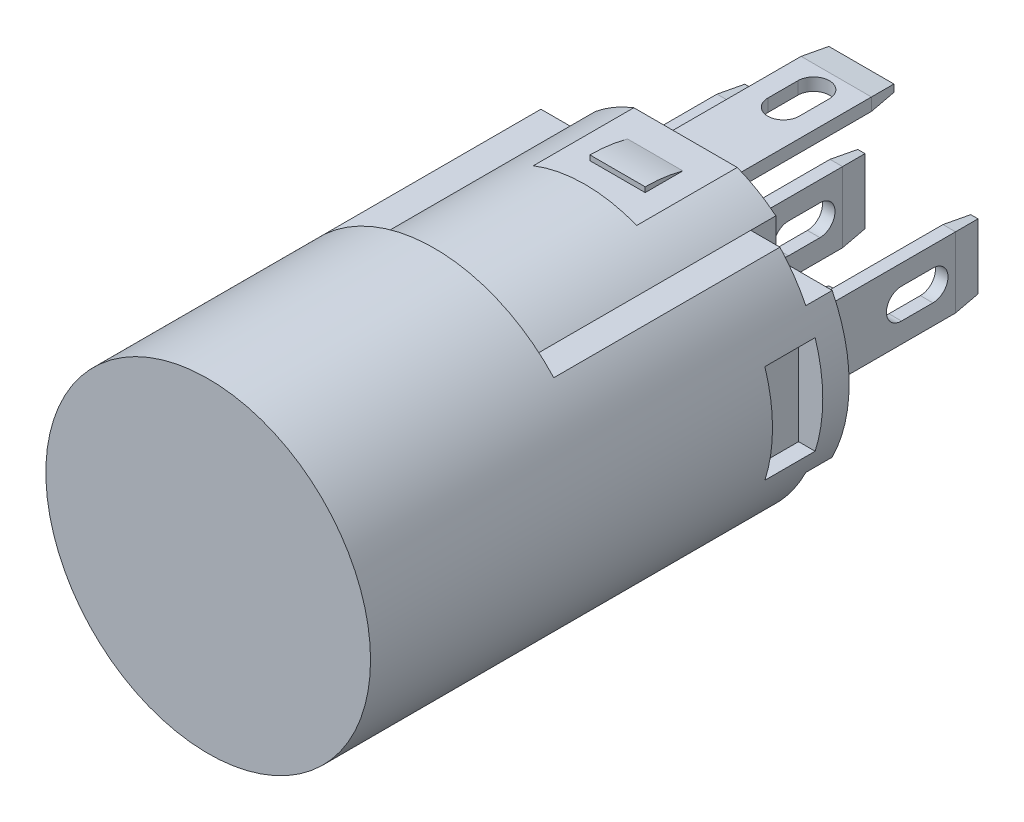
from build123d import *
from OCP.BRepFilletAPI import BRepFilletAPI_MakeChamfer

# Parameters (mm, degrees)
SKETCH1_R             = 6.462380214
BOSS_EXTRUDE1_DEPTH   = 19
CUT_EXTRUDE1_START    = -10
CUT_EXTRUDE1_DEPTH    = 10
SKETCH3_W             = 0.5
SKETCH3_H             = 2.8
BOSS_EXTRUDE2_DEPTH   = 7
SKETCH3_W_2           = 2.8
SKETCH3_H_2           = 0.5
BOSS_EXTRUDE2_2_DEPTH = 7
BOSS_EXTRUDE2_3_DEPTH = 7
BOSS_EXTRUDE2_4_DEPTH = 7
BOSS_EXTRUDE2_5_DEPTH = 7
CHAMFER1_SIZE         = 1
CHAMFER1_SIZE2        = 0.105104235
CHAMFER2_SIZE         = 1
CHAMFER2_SIZE2        = 0.105104235
CHAMFER3_SIZE         = 1
CHAMFER3_SIZE2        = 0.105104235
CHAMFER4_SIZE         = 1
CHAMFER4_SIZE2        = 0.105104235
CHAMFER5_SIZE         = 1
CHAMFER5_SIZE2        = 0.105104235
CUT_EXTRUDE2_DEPTH    = 15
CUT_EXTRUDE3_DEPTH    = 15
CUT_EXTRUDE4_START    = -1
CUT_EXTRUDE4_DEPTH    = 1
SKETCH8_W             = 8.882944393
SKETCH8_H             = 5.949994893
SKETCH8_W_2           = 9.676756497
SKETCH8_H_2           = 2.378455265
CUT_EXTRUDE5_DEPTH    = 4
SKETCH10_W            = 1.25
SKETCH10_H            = 1
CUT_EXTRUDE6_DEPTH    = 0.3
BOSS_EXTRUDE4_DEPTH   = 0.05
SKETCH12_W            = 0.6
SKETCH12_H            = 2.9
SKETCH12_W_2          = 2.9
SKETCH12_H_2          = 0.6
CUT_EXTRUDE7_DEPTH    = 0.5
SKETCH13_W            = 0.5
SKETCH13_H            = 2.8
SKETCH13_W_2          = 2.8
SKETCH13_H_2          = 0.5
BOSS_EXTRUDE5_DEPTH   = 0.5
SKETCH15_W            = 0.4
SKETCH15_H            = 0.2
SKETCH15_W_2          = 0.2
SKETCH15_H_2          = 0.4
SKETCH15_H_3          = 1
BOSS_EXTRUDE6_DEPTH   = 0.1
SKETCH16_W            = 2.2
SKETCH16_H            = 1.5
BOSS_EXTRUDE7_DEPTH   = 0.2
SKETCH17_W            = 2.2
SKETCH17_H            = 1.5
BOSS_EXTRUDE8_DEPTH   = 0.2
FILLET2_R             = 5.725
CUT_EXTRUDE9_DEPTH    = 0.2
SKETCH19_W            = 2
SKETCH19_H            = 3.916637546
CUT_EXTRUDE10_DEPTH   = 4.5


# Read off the part's stored shape, not the designer's step: Boss-Extrude4
with BuildPart() as part:
    # Sketch1 → Boss-Extrude1 (new body)
    with BuildSketch(Plane.XY):
        Circle(SKETCH1_R)
    extrude(amount=-BOSS_EXTRUDE1_DEPTH)

    # Sketch2 → Cut-Extrude1 (cut)
    with BuildSketch(Plane(origin=(0, 0, -19), x_dir=(-1, 0, 0), z_dir=(0, 0, -1)).offset(CUT_EXTRUDE1_START)):
        with BuildLine():
            ThreePointArc((4.756230968, 4.375), (0, 6.462380214), (-4.756230968, 4.375))
            Line((-4.756230968, 4.375), (-3.594707872, 4.375))
            ThreePointArc((-3.594707872, 4.375), (0, 5.662380214), (3.594707872, 4.375))
            Line((3.594707872, 4.375), (4.756230968, 4.375))
        make_face()
        with BuildLine():
            Line((-3.594707872, -4.375), (-4.756230968, -4.375))
            ThreePointArc((-4.756230968, -4.375), (0, -6.462380214), (4.756230968, -4.375))
            Line((4.756230968, -4.375), (3.594707872, -4.375))
            ThreePointArc((3.594707872, -4.375), (0, -5.662380214), (-3.594707872, -4.375))
        make_face()
    extrude(amount=CUT_EXTRUDE1_DEPTH, mode=Mode.SUBTRACT)

    # Sketch7 → Cut-Extrude4 (cut)
    with BuildSketch(Plane(origin=(0, 0, -19), x_dir=(-1, 0, 0), z_dir=(0, 0, -1)).offset(CUT_EXTRUDE4_START)):
        with BuildLine():
            Line((3.594707872, -2.875), (3.594707872, -4.375))
            Line((3.594707872, -4.375), (4.756230968, -4.375))
            ThreePointArc((4.756230968, -4.375), (5.325014913, -3.661498901), (5.787636221, -2.875))
            Line((5.787636221, -2.875), (3.594707872, -2.875))
        make_face()
        with BuildLine():
            Line((-4.756230968, -4.375), (-3.594707872, -4.375))
            Line((-3.594707872, -4.375), (-3.594707872, -2.875))
            Line((-3.594707872, -2.875), (-5.787636221, -2.875))
            ThreePointArc((-5.787636221, -2.875), (-5.325014913, -3.661498901), (-4.756230968, -4.375))
        make_face()
        with BuildLine():
            ThreePointArc((-4.756230968, 4.375), (-5.325014913, 3.661498901), (-5.787636221, 2.875))
            Line((-5.787636221, 2.875), (-3.594707872, 2.875))
            Line((-3.594707872, 2.875), (-3.594707872, 4.375))
            Line((-3.594707872, 4.375), (-4.756230968, 4.375))
        make_face()
        with BuildLine():
            Line((3.594707872, 2.875), (5.787636221, 2.875))
            ThreePointArc((5.787636221, 2.875), (5.325014913, 3.661498901), (4.756230968, 4.375))
            Line((4.756230968, 4.375), (3.594707872, 4.375))
            Line((3.594707872, 4.375), (3.594707872, 2.875))
        make_face()
    extrude(amount=CUT_EXTRUDE4_DEPTH, mode=Mode.SUBTRACT)

    # Sketch8 → Cut-Extrude5 (cut)
    with BuildSketch(Plane(origin=(0, 0, -19), x_dir=(-1, 0, 0), z_dir=(0, 0, -1))):
        with Locations((0.00649082, 8.249997447)):
            Rectangle(SKETCH8_W, SKETCH8_H)
        with Locations((0.006490821, -6.464227633)):
            Rectangle(SKETCH8_W_2, SKETCH8_H_2)
    extrude(amount=-CUT_EXTRUDE5_DEPTH, mode=Mode.SUBTRACT)

    # Sketch10 → Cut-Extrude6 (cut)
    with BuildSketch(Plane(origin=(0, 0, -19), x_dir=(-1, 0, 0), z_dir=(0, 0, -1))):
        with Locations((0, 3.375)):
            Rectangle(SKETCH10_W, SKETCH10_H)
        with Locations((0, -3.375)):
            Rectangle(SKETCH10_W, SKETCH10_H)
    extrude(amount=-CUT_EXTRUDE6_DEPTH, mode=Mode.SUBTRACT)

    # Boss-Extrude4 outline → Boss-Extrude4 (add)
    with BuildSketch(Plane(origin=(0, 0, -19), x_dir=(-1, 0, 0), z_dir=(0, 0, -1))):
        with BuildLine():
            ThreePointArc((5.787636221, -2.875), (6.462380214, 0), (5.787636221, 2.875))
            Line((5.787636221, 2.875), (-5.787636221, 2.875))
            ThreePointArc((-5.787636221, 2.875), (-6.462380214, 0), (-5.787636221, -2.875))
            Line((-5.787636221, -2.875), (5.787636221, -2.875))
        make_face()
    extrude(amount=BOSS_EXTRUDE4_DEPTH)

    # Sketch12 → Cut-Extrude7 (cut, symmetric)
    with BuildSketch(Plane(origin=(0, 0, -19.05), x_dir=(-1, 0, 0), z_dir=(0, 0, -1))):
        with Locations((-4.496812591, 0)):
            Rectangle(SKETCH12_W, SKETCH12_H)
        Rectangle(SKETCH12_W, SKETCH12_H)
        with Locations((4.496812591, 0)):
            Rectangle(SKETCH12_W, SKETCH12_H)
        with Locations((0, 4.125)):
            Rectangle(SKETCH12_W_2, SKETCH12_H_2)
        with Locations((0, -4.125)):
            Rectangle(SKETCH12_W_2, SKETCH12_H_2)
    extrude(amount=CUT_EXTRUDE7_DEPTH, both=True, mode=Mode.SUBTRACT)

    # Sketch15 → Boss-Extrude6 (add)
    with BuildSketch(Plane(origin=(0, 0, -19), x_dir=(-1, 0, 0), z_dir=(0, 0, -1))):
        with Locations((2.129333431, -4.075)):
            Rectangle(SKETCH15_W, SKETCH15_H)
        with Locations((2.429333431, -4.375)):
            Rectangle(SKETCH15_W_2, SKETCH15_H_2)
        with Locations((2.729333431, -4.075)):
            Rectangle(SKETCH15_W, SKETCH15_H)
        with Locations((2.429333431, -4.075)):
            Rectangle(SKETCH15_W_2, SKETCH15_H)
        with Locations((2.429333431, -3.775)):
            Rectangle(SKETCH15_W_2, SKETCH15_H_2)
        with Locations((2.429333431, 4.075)):
            Rectangle(SKETCH15_W_2, SKETCH15_H_3)
    extrude(amount=BOSS_EXTRUDE6_DEPTH)

    # Sketch16 → Boss-Extrude7 (add)
    with BuildSketch(Plane.XZ.offset(5.275)):
        with Locations((-0.004713943, -17.05)):
            Rectangle(SKETCH16_W, SKETCH16_H)
    extrude(amount=BOSS_EXTRUDE7_DEPTH)

    # Sketch17 → Boss-Extrude8 (add)
    with BuildSketch(Plane(origin=(0, 5.275, 0), x_dir=(1, 0, 0), z_dir=(0, 1, 0))):
        with Locations((-0.004713943, 17.05)):
            Rectangle(SKETCH17_W, SKETCH17_H)
    extrude(amount=BOSS_EXTRUDE8_DEPTH)

    # Fillet2
    # the kernel refuses this fillet: 5.725 mm, written as the material it takes off along each edge
    with BuildSketch(Plane(origin=(-4.854713943, -5.475, -17.8), x_dir=(0, 1, 0), z_dir=(1, 0, 0)), Plane(origin=(4.845286057, 5.475, -17.8), x_dir=(0, -1, 0), z_dir=(-1, 0, 0))) as fillet2_piece_1:
        with BuildLine():
            CenterArc((5.725, 1.5), FILLET2_R, 180, 15.189286737)
            Line((0, 1.5), (-0.1145, 1.5))
            Line((-0.1145, 1.5), (-0.1145, 0))
            Line((-0.1145, 0), (0, -0.1145))
            ThreePointArc((0, -0.1145), (0.1, -0.1145), (0.0895, -0.03))
            Line((0.0895, -0.03), (0.2, 0))
        make_face()
    extrude(amount=9.7, mode=Mode.SUBTRACT)

    # Sketch14 → Cut-Extrude9 (cut)
    with BuildSketch(Plane(origin=(0, 0, -19.05), x_dir=(-1, 0, 0), z_dir=(0, 0, -1))):
        with BuildLine():
            Line((-4.696812591, 2.25), (-3.696812591, 2.25))
            ThreePointArc((-3.696812591, 2.25), (-3.555391234, 2.191421356), (-3.496812591, 2.05))
            Line((-3.496812591, 2.05), (-3.496812591, -0.05))
            ThreePointArc((-3.496812591, -0.05), (-3.438233947, -0.191421356), (-3.296812591, -0.25))
            Line((-3.296812591, -0.25), (-2.796812591, -0.25))
            ThreePointArc((-2.796812591, -0.25), (-2.655391234, -0.308578644), (-2.596812591, -0.45))
            Line((-2.596812591, -0.45), (-2.596812591, -2.05))
            ThreePointArc((-2.596812591, -2.05), (-2.655391234, -2.191421356), (-2.796812591, -2.25))
            Line((-2.796812591, -2.25), (-3.296812591, -2.25))
            Line((-3.296812591, -2.25), (-4.696812591, -2.25))
            ThreePointArc((-4.696812591, -2.25), (-4.838233947, -2.191421356), (-4.896812591, -2.05))
            Line((-4.896812591, -2.05), (-4.896812591, 2.05))
            ThreePointArc((-4.896812591, 2.05), (-4.838233947, 2.191421356), (-4.696812591, 2.25))
        make_face()
        with BuildLine():
            Line((4.896812591, 2.05), (4.896812591, -2.05))
            ThreePointArc((4.896812591, -2.05), (4.838233947, -2.191421356), (4.696812591, -2.25))
            Line((4.696812591, -2.25), (3.696812591, -2.25))
            ThreePointArc((3.696812591, -2.25), (3.555391234, -2.191421356), (3.496812591, -2.05))
            Line((3.496812591, -2.05), (3.496812591, -0.05))
            Line((3.496812591, -0.05), (3.496812591, 0.05))
            ThreePointArc((3.496812591, 0.05), (3.438233947, 0.191421356), (3.296812591, 0.25))
            Line((3.296812591, 0.25), (2.796812591, 0.25))
            ThreePointArc((2.796812591, 0.25), (2.655391234, 0.308578644), (2.596812591, 0.45))
            Line((2.596812591, 0.45), (2.596812591, 2.05))
            ThreePointArc((2.596812591, 2.05), (2.655391234, 2.191421356), (2.796812591, 2.25))
            Line((2.796812591, 2.25), (3.296812591, 2.25))
            Line((3.296812591, 2.25), (3.696812591, 2.25))
            Line((3.696812591, 2.25), (4.696812591, 2.25))
            ThreePointArc((4.696812591, 2.25), (4.838233947, 2.191421356), (4.896812591, 2.05))
        make_face()
        with BuildLine():
            Line((-1.7, 2.25), (0.2, 2.25))
            ThreePointArc((0.2, 2.25), (0.341421356, 2.191421356), (0.4, 2.05))
            Line((0.4, 2.05), (0.4, -2.05))
            ThreePointArc((0.4, -2.05), (0.341421356, -2.191421356), (0.2, -2.25))
            Line((0.2, -2.25), (-0.8, -2.25))
            ThreePointArc((-0.8, -2.25), (-0.941421356, -2.191421356), (-1, -2.05))
            Line((-1, -2.05), (-1, 0.05))
            ThreePointArc((-1, 0.05), (-1.058578644, 0.191421356), (-1.2, 0.25))
            Line((-1.2, 0.25), (-1.7, 0.25))
            ThreePointArc((-1.7, 0.25), (-1.841421356, 0.308578644), (-1.9, 0.45))
            Line((-1.9, 0.45), (-1.9, 2.05))
            ThreePointArc((-1.9, 2.05), (-1.841421356, 2.191421356), (-1.7, 2.25))
        make_face()
    extrude(amount=-CUT_EXTRUDE9_DEPTH, mode=Mode.SUBTRACT)

    # Sketch19 → Cut-Extrude10 (cut)
    with BuildSketch(Plane(origin=(10, 0, 0), x_dir=(0, 0, -1), z_dir=(1, 0, 0))):
        with Locations((17, 0)):
            Rectangle(SKETCH19_W, SKETCH19_H)
    cut_extrude10 = extrude(amount=-CUT_EXTRUDE10_DEPTH, mode=Mode.SUBTRACT)

    # Mirror1: Cut-Extrude10 across plane
    add(cut_extrude10.mirror(Plane(origin=(0, 0, 0), x_dir=(0, 0, 1), z_dir=(1, 0, 0))), mode=Mode.SUBTRACT)


with BuildPart() as body_2:
    # Sketch3 → Boss-Extrude2 (new body)
    with BuildSketch(Plane(origin=(0, 0, -19), x_dir=(-1, 0, 0), z_dir=(0, 0, -1))):
        with Locations((-4.496812591, 0)):
            Rectangle(SKETCH3_W, SKETCH3_H)
    extrude(amount=BOSS_EXTRUDE2_DEPTH)

    # Chamfer2: one chamfer whose edges measure the first distance from different faces: ONE call of the kernel's chamfer builder (chamfer() names one face for all edges)
    chamfer2_edges_1 = [body_2.edges().sort_by_distance(p)[0] for p in [
        (4.246812591, 0, -26),
    ]]
    chamfer2_side_1 = [body_2.faces().sort_by_distance(p)[0] for p in [
        (4.246812591, 0, -22.5),
    ]]
    chamfer2_edges_2 = [body_2.edges().sort_by_distance(p)[0] for p in [
        (4.496812591, 1.4, -26),
    ]]
    chamfer2_side_2 = [body_2.faces().sort_by_distance(p)[0] for p in [
        (4.496812591, 1.4, -22.5),
    ]]
    chamfer2_edges_3 = [body_2.edges().sort_by_distance(p)[0] for p in [
        (4.746812591, 0, -26),
    ]]
    chamfer2_side_3 = [body_2.faces().sort_by_distance(p)[0] for p in [
        (4.746812591, 0, -22.5),
    ]]
    chamfer2_edges_4 = [body_2.edges().sort_by_distance(p)[0] for p in [
        (4.496812591, -1.4, -26),
    ]]
    chamfer2_side_4 = [body_2.faces().sort_by_distance(p)[0] for p in [
        (4.496812591, -1.4, -22.5),
    ]]
    chamfer2 = BRepFilletAPI_MakeChamfer(body_2.part.solid().wrapped)
    for e in chamfer2_edges_1:
        chamfer2.Add(CHAMFER2_SIZE, CHAMFER2_SIZE2, e.wrapped, chamfer2_side_1[0].wrapped)  # the first distance lies on this face
    for e in chamfer2_edges_2:
        chamfer2.Add(CHAMFER2_SIZE, CHAMFER2_SIZE2, e.wrapped, chamfer2_side_2[0].wrapped)  # the first distance lies on this face
    for e in chamfer2_edges_3:
        chamfer2.Add(CHAMFER2_SIZE, CHAMFER2_SIZE2, e.wrapped, chamfer2_side_3[0].wrapped)  # the first distance lies on this face
    for e in chamfer2_edges_4:
        chamfer2.Add(CHAMFER2_SIZE, CHAMFER2_SIZE2, e.wrapped, chamfer2_side_4[0].wrapped)  # the first distance lies on this face
    add(Compound.cast(chamfer2.Shape()), mode=Mode.REPLACE)


with BuildPart() as body_3:
    # Sketch3 → Boss-Extrude2 2 (new body)
    with BuildSketch(Plane(origin=(0, 0, -19), x_dir=(-1, 0, 0), z_dir=(0, 0, -1))):
        with Locations((0, 4.125)):
            Rectangle(SKETCH3_W_2, SKETCH3_H_2)
    extrude(amount=BOSS_EXTRUDE2_2_DEPTH)

    # Chamfer4: one chamfer whose edges measure the first distance from different faces: ONE call of the kernel's chamfer builder (chamfer() names one face for all edges)
    chamfer4_edges_1 = [body_3.edges().sort_by_distance(p)[0] for p in [
        (1.4, 4.125, -26),
    ]]
    chamfer4_side_1 = [body_3.faces().sort_by_distance(p)[0] for p in [
        (1.4, 4.125, -22.5),
    ]]
    chamfer4_edges_2 = [body_3.edges().sort_by_distance(p)[0] for p in [
        (0, 3.875, -26),
    ]]
    chamfer4_side_2 = [body_3.faces().sort_by_distance(p)[0] for p in [
        (0, 3.875, -22.5),
    ]]
    chamfer4_edges_3 = [body_3.edges().sort_by_distance(p)[0] for p in [
        (-1.4, 4.125, -26),
    ]]
    chamfer4_side_3 = [body_3.faces().sort_by_distance(p)[0] for p in [
        (-1.4, 4.125, -22.5),
    ]]
    chamfer4_edges_4 = [body_3.edges().sort_by_distance(p)[0] for p in [
        (0, 4.375, -26),
    ]]
    chamfer4_side_4 = [body_3.faces().sort_by_distance(p)[0] for p in [
        (0, 4.375, -22.5),
    ]]
    chamfer4 = BRepFilletAPI_MakeChamfer(body_3.part.solid().wrapped)
    for e in chamfer4_edges_1:
        chamfer4.Add(CHAMFER4_SIZE, CHAMFER4_SIZE2, e.wrapped, chamfer4_side_1[0].wrapped)  # the first distance lies on this face
    for e in chamfer4_edges_2:
        chamfer4.Add(CHAMFER4_SIZE, CHAMFER4_SIZE2, e.wrapped, chamfer4_side_2[0].wrapped)  # the first distance lies on this face
    for e in chamfer4_edges_3:
        chamfer4.Add(CHAMFER4_SIZE, CHAMFER4_SIZE2, e.wrapped, chamfer4_side_3[0].wrapped)  # the first distance lies on this face
    for e in chamfer4_edges_4:
        chamfer4.Add(CHAMFER4_SIZE, CHAMFER4_SIZE2, e.wrapped, chamfer4_side_4[0].wrapped)  # the first distance lies on this face
    add(Compound.cast(chamfer4.Shape()), mode=Mode.REPLACE)


with BuildPart() as body_4:
    # Sketch3 → Boss-Extrude2 3 (new body)
    with BuildSketch(Plane(origin=(0, 0, -19), x_dir=(-1, 0, 0), z_dir=(0, 0, -1))):
        with Locations((0, -4.125)):
            Rectangle(SKETCH3_W_2, SKETCH3_H_2)
    extrude(amount=BOSS_EXTRUDE2_3_DEPTH)

    # Chamfer5: one chamfer whose edges measure the first distance from different faces: ONE call of the kernel's chamfer builder (chamfer() names one face for all edges)
    chamfer5_edges_1 = [body_4.edges().sort_by_distance(p)[0] for p in [
        (-1.4, -4.125, -26),
    ]]
    chamfer5_side_1 = [body_4.faces().sort_by_distance(p)[0] for p in [
        (-1.4, -4.125, -22.5),
    ]]
    chamfer5_edges_2 = [body_4.edges().sort_by_distance(p)[0] for p in [
        (0, -3.875, -26),
    ]]
    chamfer5_side_2 = [body_4.faces().sort_by_distance(p)[0] for p in [
        (0, -3.875, -22.5),
    ]]
    chamfer5_edges_3 = [body_4.edges().sort_by_distance(p)[0] for p in [
        (1.4, -4.125, -26),
    ]]
    chamfer5_side_3 = [body_4.faces().sort_by_distance(p)[0] for p in [
        (1.4, -4.125, -22.5),
    ]]
    chamfer5_edges_4 = [body_4.edges().sort_by_distance(p)[0] for p in [
        (0, -4.375, -26),
    ]]
    chamfer5_side_4 = [body_4.faces().sort_by_distance(p)[0] for p in [
        (0, -4.375, -22.5),
    ]]
    chamfer5 = BRepFilletAPI_MakeChamfer(body_4.part.solid().wrapped)
    for e in chamfer5_edges_1:
        chamfer5.Add(CHAMFER5_SIZE, CHAMFER5_SIZE2, e.wrapped, chamfer5_side_1[0].wrapped)  # the first distance lies on this face
    for e in chamfer5_edges_2:
        chamfer5.Add(CHAMFER5_SIZE, CHAMFER5_SIZE2, e.wrapped, chamfer5_side_2[0].wrapped)  # the first distance lies on this face
    for e in chamfer5_edges_3:
        chamfer5.Add(CHAMFER5_SIZE, CHAMFER5_SIZE2, e.wrapped, chamfer5_side_3[0].wrapped)  # the first distance lies on this face
    for e in chamfer5_edges_4:
        chamfer5.Add(CHAMFER5_SIZE, CHAMFER5_SIZE2, e.wrapped, chamfer5_side_4[0].wrapped)  # the first distance lies on this face
    add(Compound.cast(chamfer5.Shape()), mode=Mode.REPLACE)


with BuildPart() as body_5:
    # Sketch3 → Boss-Extrude2 4 (new body)
    with BuildSketch(Plane(origin=(0, 0, -19), x_dir=(-1, 0, 0), z_dir=(0, 0, -1))):
        with Locations((4.496812591, 0)):
            Rectangle(SKETCH3_W, SKETCH3_H)
    extrude(amount=BOSS_EXTRUDE2_4_DEPTH)

    # Chamfer1: one chamfer whose edges measure the first distance from different faces: ONE call of the kernel's chamfer builder (chamfer() names one face for all edges)
    chamfer1_edges_1 = [body_5.edges().sort_by_distance(p)[0] for p in [
        (-4.746812591, 0, -26),
    ]]
    chamfer1_side_1 = [body_5.faces().sort_by_distance(p)[0] for p in [
        (-4.746812591, 0, -22.5),
    ]]
    chamfer1_edges_2 = [body_5.edges().sort_by_distance(p)[0] for p in [
        (-4.496812591, 1.4, -26),
    ]]
    chamfer1_side_2 = [body_5.faces().sort_by_distance(p)[0] for p in [
        (-4.496812591, 1.4, -22.5),
    ]]
    chamfer1_edges_3 = [body_5.edges().sort_by_distance(p)[0] for p in [
        (-4.246812591, 0, -26),
    ]]
    chamfer1_side_3 = [body_5.faces().sort_by_distance(p)[0] for p in [
        (-4.246812591, 0, -22.5),
    ]]
    chamfer1_edges_4 = [body_5.edges().sort_by_distance(p)[0] for p in [
        (-4.496812591, -1.4, -26),
    ]]
    chamfer1_side_4 = [body_5.faces().sort_by_distance(p)[0] for p in [
        (-4.496812591, -1.4, -22.5),
    ]]
    chamfer1 = BRepFilletAPI_MakeChamfer(body_5.part.solid().wrapped)
    for e in chamfer1_edges_1:
        chamfer1.Add(CHAMFER1_SIZE, CHAMFER1_SIZE2, e.wrapped, chamfer1_side_1[0].wrapped)  # the first distance lies on this face
    for e in chamfer1_edges_2:
        chamfer1.Add(CHAMFER1_SIZE, CHAMFER1_SIZE2, e.wrapped, chamfer1_side_2[0].wrapped)  # the first distance lies on this face
    for e in chamfer1_edges_3:
        chamfer1.Add(CHAMFER1_SIZE, CHAMFER1_SIZE2, e.wrapped, chamfer1_side_3[0].wrapped)  # the first distance lies on this face
    for e in chamfer1_edges_4:
        chamfer1.Add(CHAMFER1_SIZE, CHAMFER1_SIZE2, e.wrapped, chamfer1_side_4[0].wrapped)  # the first distance lies on this face
    add(Compound.cast(chamfer1.Shape()), mode=Mode.REPLACE)


with BuildPart() as body_6:
    # Sketch3 → Boss-Extrude2 5 (new body)
    with BuildSketch(Plane(origin=(0, 0, -19), x_dir=(-1, 0, 0), z_dir=(0, 0, -1))):
        Rectangle(SKETCH3_W, SKETCH3_H)
    extrude(amount=BOSS_EXTRUDE2_5_DEPTH)

    # Chamfer3: one chamfer whose edges measure the first distance from different faces: ONE call of the kernel's chamfer builder (chamfer() names one face for all edges)
    chamfer3_edges_1 = [body_6.edges().sort_by_distance(p)[0] for p in [
        (-0.25, 0, -26),
    ]]
    chamfer3_side_1 = [body_6.faces().sort_by_distance(p)[0] for p in [
        (-0.25, 0, -22.5),
    ]]
    chamfer3_edges_2 = [body_6.edges().sort_by_distance(p)[0] for p in [
        (0, 1.4, -26),
    ]]
    chamfer3_side_2 = [body_6.faces().sort_by_distance(p)[0] for p in [
        (0, 1.4, -22.5),
    ]]
    chamfer3_edges_3 = [body_6.edges().sort_by_distance(p)[0] for p in [
        (0.25, 0, -26),
    ]]
    chamfer3_side_3 = [body_6.faces().sort_by_distance(p)[0] for p in [
        (0.25, 0, -22.5),
    ]]
    chamfer3_edges_4 = [body_6.edges().sort_by_distance(p)[0] for p in [
        (0, -1.4, -26),
    ]]
    chamfer3_side_4 = [body_6.faces().sort_by_distance(p)[0] for p in [
        (0, -1.4, -22.5),
    ]]
    chamfer3 = BRepFilletAPI_MakeChamfer(body_6.part.solid().wrapped)
    for e in chamfer3_edges_1:
        chamfer3.Add(CHAMFER3_SIZE, CHAMFER3_SIZE2, e.wrapped, chamfer3_side_1[0].wrapped)  # the first distance lies on this face
    for e in chamfer3_edges_2:
        chamfer3.Add(CHAMFER3_SIZE, CHAMFER3_SIZE2, e.wrapped, chamfer3_side_2[0].wrapped)  # the first distance lies on this face
    for e in chamfer3_edges_3:
        chamfer3.Add(CHAMFER3_SIZE, CHAMFER3_SIZE2, e.wrapped, chamfer3_side_3[0].wrapped)  # the first distance lies on this face
    for e in chamfer3_edges_4:
        chamfer3.Add(CHAMFER3_SIZE, CHAMFER3_SIZE2, e.wrapped, chamfer3_side_4[0].wrapped)  # the first distance lies on this face
    add(Compound.cast(chamfer3.Shape()), mode=Mode.REPLACE)


with BuildPart() as cut_extrude2_tool:
    # Sketch4 → Cut-Extrude2 (new body)
    with BuildSketch(Plane(origin=(4.746812591, 0, 0), x_dir=(0, 0, -1), z_dir=(1, 0, 0))):
        with BuildLine():
            Line((22.85, 0.6), (24.1, 0.6))
            ThreePointArc((24.1, 0.6), (24.7, 0), (24.1, -0.6))
            Line((24.1, -0.6), (22.85, -0.6))
            ThreePointArc((22.85, -0.6), (22.25, 0), (22.85, 0.6))
        make_face()
    extrude(amount=-CUT_EXTRUDE2_DEPTH)


with BuildPart() as body_2_1:
    add(body_2.part)

    # Cut-Extrude2: cut by cut_extrude2_tool
    add(cut_extrude2_tool.part, mode=Mode.SUBTRACT)



with BuildPart() as body_5_1:
    add(body_5.part)

    # Cut-Extrude2: cut by cut_extrude2_tool
    add(cut_extrude2_tool.part, mode=Mode.SUBTRACT)


with BuildPart() as body_6_1:
    add(body_6.part)

    # Cut-Extrude2: cut by cut_extrude2_tool
    add(cut_extrude2_tool.part, mode=Mode.SUBTRACT)


with BuildPart() as cut_extrude3_tool:
    # Sketch6 → Cut-Extrude3 (new body)
    with BuildSketch(Plane.XZ.offset(4.375)):
        with BuildLine():
            Line((-0.625, -24.1), (-0.625, -22.9))
            ThreePointArc((-0.625, -22.9), (0, -22.275), (0.625, -22.9))
            Line((0.625, -22.9), (0.625, -24.1))
            ThreePointArc((0.625, -24.1), (0, -24.725), (-0.625, -24.1))
        make_face()
    extrude(amount=-CUT_EXTRUDE3_DEPTH)


with BuildPart() as body_4_1:
    add(body_4.part)

    # Cut-Extrude3: cut by cut_extrude3_tool
    add(cut_extrude3_tool.part, mode=Mode.SUBTRACT)


with BuildPart() as body_3_1:
    add(body_3.part)

    # Cut-Extrude3: cut by cut_extrude3_tool
    add(cut_extrude3_tool.part, mode=Mode.SUBTRACT)


with BuildPart() as body_2_2:
    add(body_2_1.part)

    add(body_4_1.part)  # Boss-Extrude5 merges body 4

    add(body_6_1.part)  # Boss-Extrude5 merges body 6

    add(body_5_1.part)  # Boss-Extrude5 merges body 5

    add(body_3_1.part)  # Boss-Extrude5 merges body 3
    # Sketch13 → Boss-Extrude5 (add)
    with BuildSketch(Plane.XY.offset(-19)):
        Rectangle(SKETCH13_W, SKETCH13_H)
        with Locations((-4.496812591, 0)):
            Rectangle(SKETCH13_W, SKETCH13_H)
        with Locations((0, -4.125)):
            Rectangle(SKETCH13_W_2, SKETCH13_H_2)
        with Locations((4.496812591, 0)):
            Rectangle(SKETCH13_W, SKETCH13_H)
        with Locations((0, 4.125)):
            Rectangle(SKETCH13_W_2, SKETCH13_H_2)
    extrude(amount=BOSS_EXTRUDE5_DEPTH)


solid = Compound([part.part, body_2_2.part])
